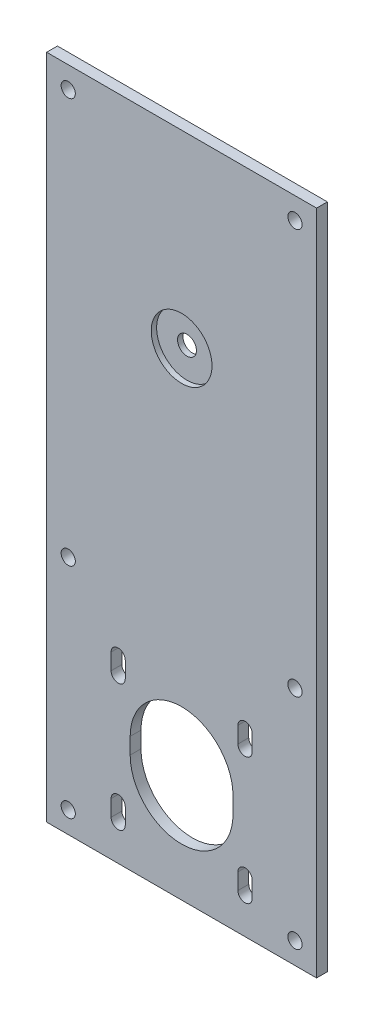
from build123d import *

# Parameters (mm, degrees)
SKETCH1_W           = 100
SKETCH1_H           = 247
SKETCH1_R           = 2.625
SKETCH1_R_2         = 3.5
BOSS_EXTRUDE1_DEPTH = 4
SKETCH2_R           = 11.25
CUT_EXTRUDE1_DEPTH  = 2


with BuildPart() as part:
    # Sketch1 → Boss-Extrude1 (new body)
    with BuildSketch(Plane.XY):
        Rectangle(SKETCH1_W, SKETCH1_H)
        with Locations((-42, -34.5)):
            Circle(SKETCH1_R, mode=Mode.SUBTRACT)
        with Locations((42, -34.5)):
            Circle(SKETCH1_R, mode=Mode.SUBTRACT)
        with Locations((-42, -115.5)):
            Circle(SKETCH1_R, mode=Mode.SUBTRACT)
        with Locations((42, -115.5)):
            Circle(SKETCH1_R, mode=Mode.SUBTRACT)
        with Locations((0, 53.5)):
            Circle(SKETCH1_R_2, mode=Mode.SUBTRACT)
        with Locations((42, 115.5)):
            Circle(SKETCH1_R, mode=Mode.SUBTRACT)
        with Locations((-42, 115.5)):
            Circle(SKETCH1_R, mode=Mode.SUBTRACT)
        with BuildLine():
            Line((-19.05, -80.5), (-19.05, -86.5))
            ThreePointArc((-19.05, -86.5), (0, -105.55), (19.05, -86.5))
            Line((19.05, -86.5), (19.05, -80.5))
            ThreePointArc((19.05, -80.5), (0, -61.45), (-19.05, -80.5))
        make_face(mode=Mode.SUBTRACT)
        with BuildLine():
            Line((-20.87, -57), (-20.87, -63))
            ThreePointArc((-20.87, -63), (-23.5, -65.63), (-26.13, -63))
            Line((-26.13, -63), (-26.13, -57))
            ThreePointArc((-26.13, -57), (-23.5, -54.37), (-20.87, -57))
        make_face(mode=Mode.SUBTRACT)
        with BuildLine():
            Line((20.87, -57), (20.87, -63))
            ThreePointArc((20.87, -63), (23.5, -65.63), (26.13, -63))
            Line((26.13, -63), (26.13, -57))
            ThreePointArc((26.13, -57), (23.5, -54.37), (20.87, -57))
        make_face(mode=Mode.SUBTRACT)
        with BuildLine():
            Line((20.87, -110), (20.87, -104))
            ThreePointArc((20.87, -104), (23.5, -101.37), (26.13, -104))
            Line((26.13, -104), (26.13, -110))
            ThreePointArc((26.13, -110), (23.5, -112.63), (20.87, -110))
        make_face(mode=Mode.SUBTRACT)
        with BuildLine():
            Line((-20.87, -110), (-20.87, -104))
            ThreePointArc((-20.87, -104), (-23.5, -101.37), (-26.13, -104))
            Line((-26.13, -104), (-26.13, -110))
            ThreePointArc((-26.13, -110), (-23.5, -112.63), (-20.87, -110))
        make_face(mode=Mode.SUBTRACT)
    extrude(amount=BOSS_EXTRUDE1_DEPTH)

    # Sketch2 → Cut-Extrude1 (cut)
    with BuildSketch(Plane.XY.offset(4)):
        with Locations((0, 53.5)):
            Circle(SKETCH2_R)
    extrude(amount=-CUT_EXTRUDE1_DEPTH, mode=Mode.SUBTRACT)


solid = part.part
